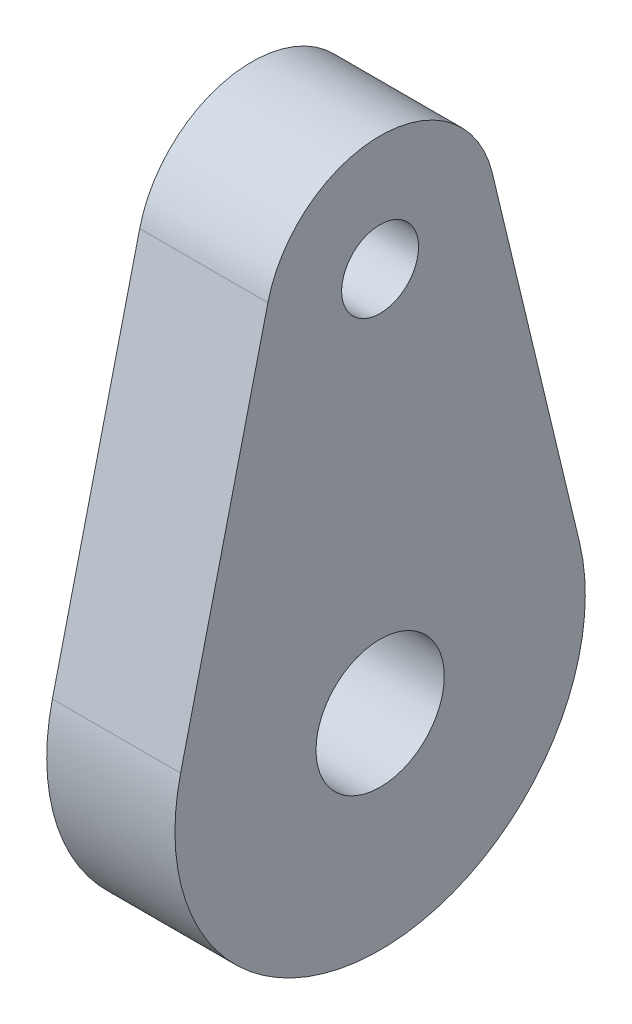
from build123d import *
from build123d.topology import SkipClean

# Parameters (mm, degrees)
SKETCH_1_R      = 2.5
SKETCH_1_R_2    = 1.5
EXTRUDE_1_DEPTH = 5
EXTRUDE_START   = 1
SKETCH_2_R      = 4.5
SKETCH_2_R_2    = 2.5
EXTRUDE_2_DEPTH = 1


with BuildPart() as part:
    # 草图1 → 凸台-拉伸1 (new body)
    with BuildSketch(Plane(origin=(0, 0, 0), x_dir=(0, 0, -1), z_dir=(1, 0, 0))):
        with BuildLine():
            Line((-7.779174478, 1.866666667), (-4.375785644, 16.05))
            ThreePointArc((-4.375785644, 16.05), (0, 19.5), (4.375785644, 16.05))
            Line((4.375785644, 16.05), (7.779174478, 1.866666667))
            ThreePointArc((7.779174478, 1.866666667), (0, -8), (-7.779174478, 1.866666667))
        make_face()
        Circle(SKETCH_1_R, mode=Mode.SUBTRACT)
        with Locations((0, 15)):
            Circle(SKETCH_1_R_2, mode=Mode.SUBTRACT)
    extrude(amount=EXTRUDE_1_DEPTH)

    # 草图2 → 凸台-拉伸2 (add)
    with SkipClean():  # the faces are left unmerged after this step: merging them gives an invalid solid
        with BuildSketch(Plane.ZY.offset(EXTRUDE_START)):
            Circle(SKETCH_2_R)
            Circle(SKETCH_2_R_2, mode=Mode.SUBTRACT)
        extrude(amount=-EXTRUDE_2_DEPTH)


solid = part.part
